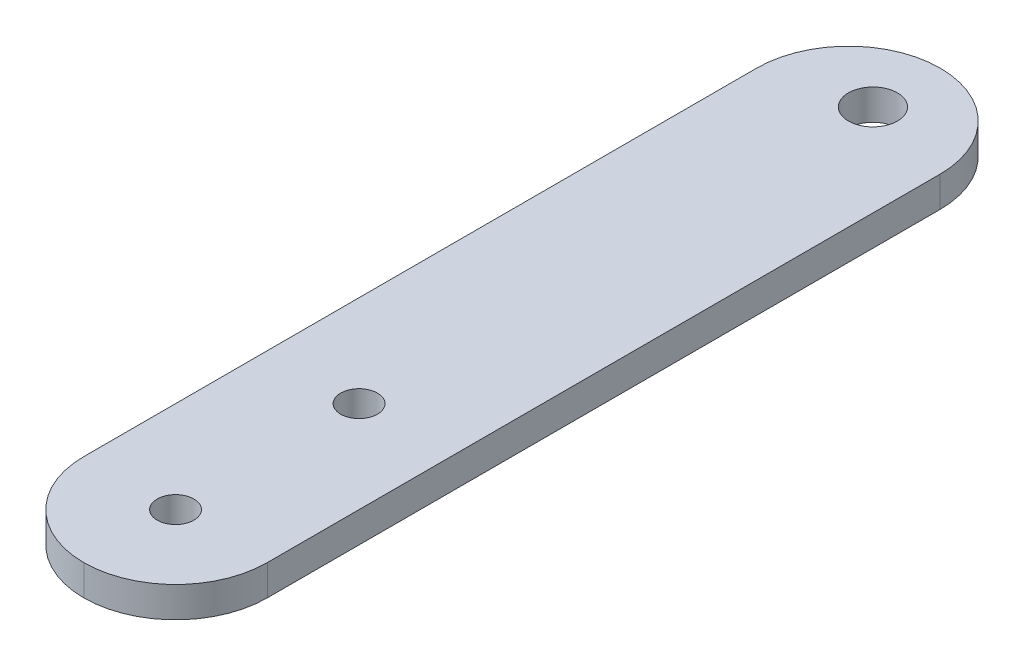
from build123d import *

# Parameters (mm, degrees)
ESQUISSE1_W      = 15
ESQUISSE1_H      = 2.5
EXTRUSION1_DEPTH = 70
CONG_1_R         = 7.5
ESQUISSE2_R      = 1.5
EXTRUSION2_DEPTH = 71.445014018
ESQUISSE3_R      = 2
EXTRUSION3_DEPTH = 71.445014018
CONG_2_R         = 7.5
ESQUISSE4_R      = 1.5
EXTRUSION4_DEPTH = 71.445014018


with BuildPart() as part:
    # Esquisse1 → Extrusion1 (new body)
    with BuildSketch(Plane.XY):
        Rectangle(ESQUISSE1_W, ESQUISSE1_H)
    extrude(amount=EXTRUSION1_DEPTH)

    # Congé1
    cong_1_edges = [part.edges().sort_by_distance(p)[0] for p in [
        (-7.5, 0, 70),
        (7.5, 0, 70),
    ]]
    fillet(cong_1_edges, radius=CONG_1_R - 0.0001)  # a hair under: the kernel refuses the full size

    # Esquisse2 → Extrusion2 (cut, through all)
    with BuildSketch(Plane(origin=(0, 1.25, 0), x_dir=(1, 0, 0), z_dir=(0, 1, 0))):
        with Locations(Location((0, -62.5, 0), (0, 0, 270))):
            Circle(ESQUISSE2_R)
    extrude(amount=-EXTRUSION2_DEPTH, mode=Mode.SUBTRACT)

    # Esquisse3 → Extrusion3 (cut, through all)
    with BuildSketch(Plane(origin=(0, 1.25, 0), x_dir=(1, 0, 0), z_dir=(0, 1, 0))):
        with Locations(Location((0, -5.5, 0), (0, 0, 270))):
            Circle(ESQUISSE3_R)
    extrude(amount=-EXTRUSION3_DEPTH, mode=Mode.SUBTRACT)

    # Congé2
    cong_2_edges = [part.edges().sort_by_distance(p)[0] for p in [
        (7.5, 0, 0),
        (-7.5, 0, 0),
    ]]
    fillet(cong_2_edges, radius=CONG_2_R - 0.0001)  # a hair under: the kernel refuses the full size

    # Esquisse4 → Extrusion4 (cut, through all)
    with BuildSketch(Plane(origin=(0, 1.25, 0), x_dir=(1, 0, 0), z_dir=(0, 1, 0))):
        with Locations(Location((0, -47.5, 0), (0, 0, 270))):
            Circle(ESQUISSE4_R)
    extrude(amount=-EXTRUSION4_DEPTH, mode=Mode.SUBTRACT)


solid = part.part
